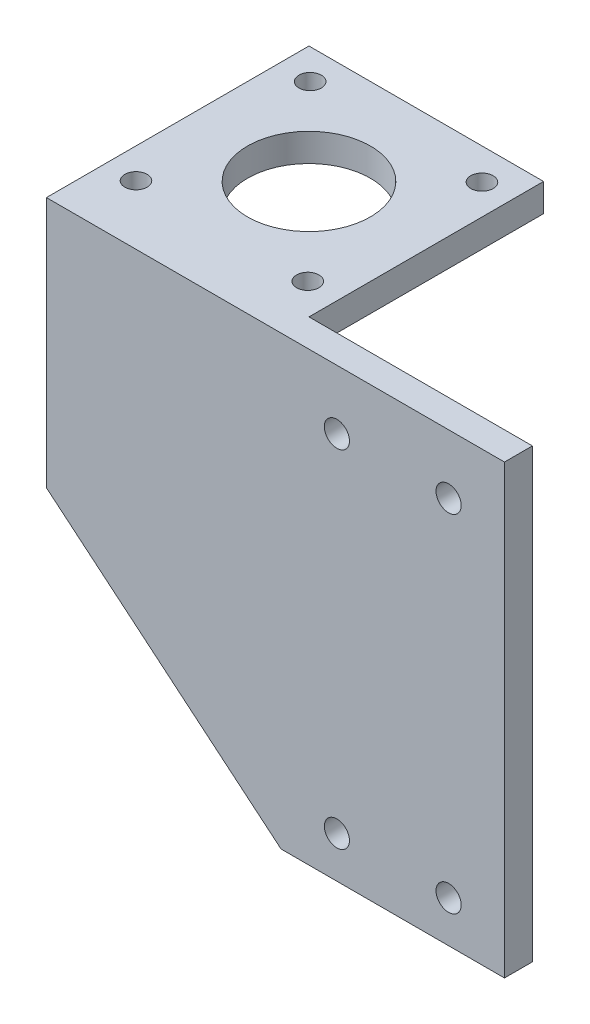
from build123d import *

# Parameters (mm, degrees)
SKETCH1_W           = 42
SKETCH1_H           = 42
SKETCH1_R           = 11
SKETCH1_R_2         = 2
BOSS_EXTRUDE1_DEPTH = 5
SKETCH2_R           = 2.25
BOSS_EXTRUDE2_DEPTH = 5


with BuildPart() as part:
    # Sketch1 → Boss-Extrude1 (new body)
    with BuildSketch(Plane(origin=(0, 0, 0), x_dir=(1, 0, 0), z_dir=(0, 1, 0))):
        Rectangle(SKETCH1_W, SKETCH1_H)
        Circle(SKETCH1_R, mode=Mode.SUBTRACT)
        with Locations((-15.592519129, -15.378015061)):
            Circle(SKETCH1_R_2, mode=Mode.SUBTRACT)
        with Locations((-15.378015061, 15.592519129)):
            Circle(SKETCH1_R_2, mode=Mode.SUBTRACT)
        with Locations((15.592519129, 15.378015061)):
            Circle(SKETCH1_R_2, mode=Mode.SUBTRACT)
        with Locations((15.378015061, -15.592519129)):
            Circle(SKETCH1_R_2, mode=Mode.SUBTRACT)
    extrude(amount=BOSS_EXTRUDE1_DEPTH)

    # Sketch2 → Boss-Extrude2 (add)
    with BuildSketch(Plane.XY.offset(21)):
        Polygon((21, 5), (61, 5), (61, -75), (21, -75), (-21, -40), (-21, 0), (-21, 5), align=None)
        with Locations((51, -67.581845608)):
            Circle(SKETCH2_R, mode=Mode.SUBTRACT)
        with Locations((31, -67.581845608)):
            Circle(SKETCH2_R, mode=Mode.SUBTRACT)
        with Locations((31, -5.627348656)):
            Circle(SKETCH2_R, mode=Mode.SUBTRACT)
        with Locations((51, -5.627348656)):
            Circle(SKETCH2_R, mode=Mode.SUBTRACT)
    extrude(amount=BOSS_EXTRUDE2_DEPTH)


solid = part.part
